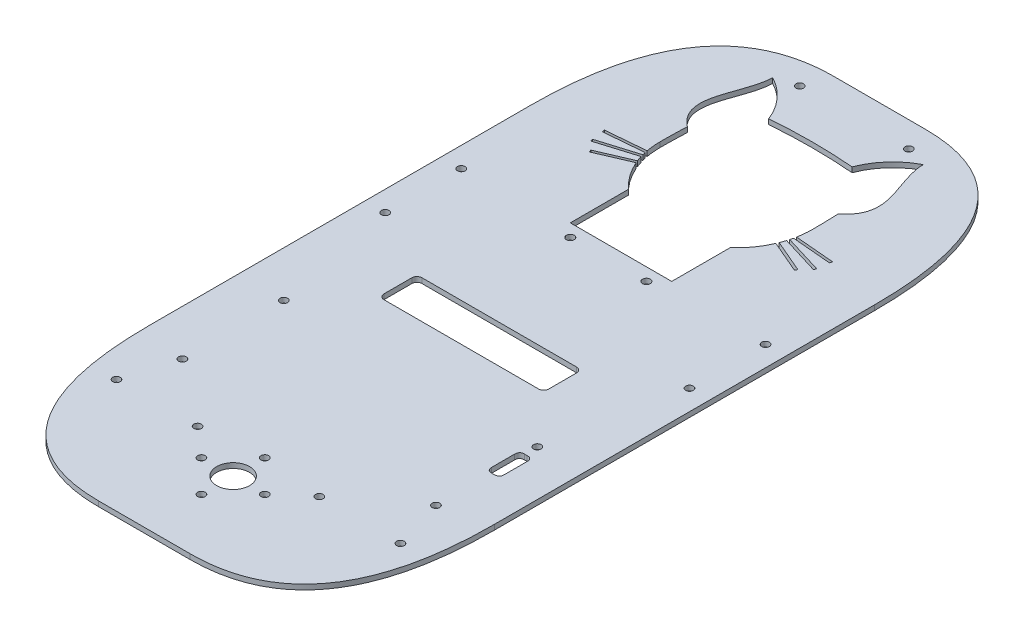
from build123d import *

# Parameters (mm, degrees)
SKETCH_1_W             = 136
SKETCH_1_H             = 290
EXTRUDE_532_DEPTH      = 2
SKETCH_12_R            = 1.5
CUT_EXTRUDE_1027_DEPTH = 174.862014253
SKETCH_9_R             = 6.5
SKETCH_9_R_2           = 1.5
CUT_EXTRUDE_2849_DEPTH = 174.862014253
SKETCH_5_R             = 1.5
RASPBERRY_DEPTH        = 174.862014253
SKETCH_11_W            = 65
SKETCH_11_H            = 15
CUT_EXTRUDE_3946_DEPTH = 174.862014253
FILLET_3_R             = 2
CUT_EXTRUDE_5288_REACH = 175.862
SKETCH_15_R            = 1.5
CUT_EXTRUDE_5884_REACH = 175.862
SKETCH_16_R            = 1.5
CUT_EXTRUDE_6361_REACH = 175.862
SKETCH_17_W            = 5
SKETCH_17_H            = 13
FILLET_4_SIZE          = 70
FILLET_4_SIZE_2        = 50
FILLET_5_SIZE          = 50
FILLET_5_SIZE_2        = 70
FILLET_6_SIZE          = 2
CUT_EXTRUDE_4_REACH    = 175.862
SKETCH_18_R            = 1.55


with BuildPart() as part:
    # Эскиз1 → Extrude 532 (new body)
    with BuildSketch(Plane(origin=(0, 0, 0), x_dir=(1, 0, 0), z_dir=(0, 1, 0))):
        with Locations((0, 15)):
            Rectangle(SKETCH_1_W, SKETCH_1_H)
    extrude(amount=EXTRUDE_532_DEPTH)

    # Эскиз12 → Cut-Extrude 1027 (cut, through all)
    with BuildSketch(Plane(origin=(0, 2, 0), x_dir=(1, 0, 0), z_dir=(0, 1, 0))):
        with Locations(Location((60, 55, 0), (0, 0, 270))):
            Circle(SKETCH_12_R)
        with Locations(Location((-60, 55, 0), (0, 0, 270))):
            Circle(SKETCH_12_R)
        with Locations(Location((-60, 25, 0), (0, 0, 270))):
            Circle(SKETCH_12_R)
        with Locations(Location((60, 25, 0), (0, 0, 270))):
            Circle(SKETCH_12_R)
    extrude(amount=-CUT_EXTRUDE_1027_DEPTH, mode=Mode.SUBTRACT)

    # Эскиз9 → Cut-Extrude 2849 (cut, through all)
    with BuildSketch(Plane(origin=(0, 2, 0), x_dir=(1, 0, 0), z_dir=(0, 1, 0))):
        with Locations(Location((0, -95, 0), (0, 0, 270))):
            Circle(SKETCH_9_R)
        with Locations(Location((0, -82.5, 0), (0, 0, 270))):
            Circle(SKETCH_9_R_2)
        with Locations(Location((12.5, -95, 0), (0, 0, 270))):
            Circle(SKETCH_9_R_2)
        with Locations(Location((-12.5, -95, 0), (0, 0, 270))):
            Circle(SKETCH_9_R_2)
        with Locations(Location((0, -107.5, 0), (0, 0, 270))):
            Circle(SKETCH_9_R_2)
    extrude(amount=-CUT_EXTRUDE_2849_DEPTH, mode=Mode.SUBTRACT)

    # Эскиз5 → raspberry (cut, through all)
    with BuildSketch(Plane(origin=(0, 2, 0), x_dir=(1, 0, 0), z_dir=(0, 1, 0))):
        with Locations(Location((-50, -25, 0), (0, 0, 270))):
            Circle(SKETCH_5_R)
        with Locations(Location((50, -25, 0), (0, 0, 270))):
            Circle(SKETCH_5_R)
        with Locations(Location((50, -65, 0), (0, 0, 270))):
            Circle(SKETCH_5_R)
        with Locations(Location((-50, -65, 0), (0, 0, 270))):
            Circle(SKETCH_5_R)
    extrude(amount=-RASPBERRY_DEPTH, mode=Mode.SUBTRACT)

    # Эскиз11 → Cut-Extrude 3946 (cut, through all)
    with BuildSketch(Plane(origin=(0, 2, 0), x_dir=(1, 0, 0), z_dir=(0, 1, 0))):
        with Locations((0, 2.5)):
            Rectangle(SKETCH_11_W, SKETCH_11_H)
    extrude(amount=-CUT_EXTRUDE_3946_DEPTH, mode=Mode.SUBTRACT)

    # Скругление3
    fillet_3_edges = [part.edges().sort_by_distance(p)[0] for p in [
        (-32.5, 1, 5),
        (-32.5, 1, -10),
        (32.5, 1, -10),
        (32.5, 1, 5),
    ]]
    fillet(fillet_3_edges, radius=FILLET_3_R)

    # Эскиз15 → Cut-Extrude 5288 (cut, up to next)
    with BuildSketch(Plane(origin=(0, 2, 0), x_dir=(1, 0, 0), z_dir=(0, 1, 0)), mode=Mode.PRIVATE) as cut_extrude_5288_sk1:
        with Locations(Location((21.5, 150, 0), (0, 0, 270))):
            Circle(SKETCH_15_R)
    cut_extrude_5288_tool1 = extrude(cut_extrude_5288_sk1.sketch, amount=-CUT_EXTRUDE_5288_REACH, mode=Mode.PRIVATE) & part.part
    # Эскиз15 → Cut-Extrude 5288 (cut, up to next)
    with BuildSketch(Plane(origin=(0, 2, 0), x_dir=(1, 0, 0), z_dir=(0, 1, 0)), mode=Mode.PRIVATE) as cut_extrude_5288_sk2:
        with Locations(Location((-21.5, 150, 0), (0, 0, 270))):
            Circle(SKETCH_15_R)
    cut_extrude_5288_tool2 = extrude(cut_extrude_5288_sk2.sketch, amount=-CUT_EXTRUDE_5288_REACH, mode=Mode.PRIVATE) & part.part
    add(cut_extrude_5288_tool1.solids().sort_by_distance((21.5, 2, -150))[0], mode=Mode.SUBTRACT)
    add(cut_extrude_5288_tool2.solids().sort_by_distance((-21.5, 2, -150))[0], mode=Mode.SUBTRACT)

    # Эскиз16 → Cut-Extrude 5884 (cut, up to next)
    with BuildSketch(Plane(origin=(0, 2, 0), x_dir=(1, 0, 0), z_dir=(0, 1, 0)), mode=Mode.PRIVATE) as cut_extrude_5884_sk1:
        with Locations(Location((-56, -85, 0), (0, 0, 270))):
            Circle(SKETCH_16_R)
    cut_extrude_5884_tool1 = extrude(cut_extrude_5884_sk1.sketch, amount=-CUT_EXTRUDE_5884_REACH, mode=Mode.PRIVATE) & part.part
    # Эскиз16 → Cut-Extrude 5884 (cut, up to next)
    with BuildSketch(Plane(origin=(0, 2, 0), x_dir=(1, 0, 0), z_dir=(0, 1, 0)), mode=Mode.PRIVATE) as cut_extrude_5884_sk2:
        with Locations(Location((-24, -85, 0), (0, 0, 270))):
            Circle(SKETCH_16_R)
    cut_extrude_5884_tool2 = extrude(cut_extrude_5884_sk2.sketch, amount=-CUT_EXTRUDE_5884_REACH, mode=Mode.PRIVATE) & part.part
    # Эскиз16 → Cut-Extrude 5884 (cut, up to next)
    with BuildSketch(Plane(origin=(0, 2, 0), x_dir=(1, 0, 0), z_dir=(0, 1, 0)), mode=Mode.PRIVATE) as cut_extrude_5884_sk3:
        with Locations(Location((24, -85, 0), (0, 0, 270))):
            Circle(SKETCH_16_R)
    cut_extrude_5884_tool3 = extrude(cut_extrude_5884_sk3.sketch, amount=-CUT_EXTRUDE_5884_REACH, mode=Mode.PRIVATE) & part.part
    # Эскиз16 → Cut-Extrude 5884 (cut, up to next)
    with BuildSketch(Plane(origin=(0, 2, 0), x_dir=(1, 0, 0), z_dir=(0, 1, 0)), mode=Mode.PRIVATE) as cut_extrude_5884_sk4:
        with Locations(Location((56, -85, 0), (0, 0, 270))):
            Circle(SKETCH_16_R)
    cut_extrude_5884_tool4 = extrude(cut_extrude_5884_sk4.sketch, amount=-CUT_EXTRUDE_5884_REACH, mode=Mode.PRIVATE) & part.part
    add(cut_extrude_5884_tool1.solids().sort_by_distance((-56, 2, 85))[0], mode=Mode.SUBTRACT)
    add(cut_extrude_5884_tool2.solids().sort_by_distance((-24, 2, 85))[0], mode=Mode.SUBTRACT)
    add(cut_extrude_5884_tool3.solids().sort_by_distance((24, 2, 85))[0], mode=Mode.SUBTRACT)
    add(cut_extrude_5884_tool4.solids().sort_by_distance((56, 2, 85))[0], mode=Mode.SUBTRACT)

    # Эскиз17 → Cut-Extrude 6361 (cut, up to next)
    with BuildSketch(Plane(origin=(0, 2, 0), x_dir=(1, 0, 0), z_dir=(0, 1, 0)), mode=Mode.PRIVATE) as cut_extrude_6361_sk1:
        with Locations((50.5, -36.5)):
            Rectangle(SKETCH_17_W, SKETCH_17_H)
    cut_extrude_6361_tool1 = extrude(cut_extrude_6361_sk1.sketch, amount=-CUT_EXTRUDE_6361_REACH, mode=Mode.PRIVATE) & part.part
    add(cut_extrude_6361_tool1.solids().sort_by_distance((50.5, 2, 36.5))[0], mode=Mode.SUBTRACT)

    # Скругление4
    # a fillet whose section is not a circle: 70, 50 mm, written as the material it takes off along each edge
    with BuildSketch(Plane(origin=(68, -175, 130), x_dir=(0, 0, -1), z_dir=(0, 1, 0))) as fillet_4_piece_1:
        with BuildLine():
            Bezier((FILLET_4_SIZE, 0), (0, 0), (0, FILLET_4_SIZE_2), weights=[1, 1, 1])
            Line((0, FILLET_4_SIZE_2), (0, 0))
            Line((0, 0), (FILLET_4_SIZE, 0))
        make_face()
    extrude(amount=352, mode=Mode.SUBTRACT)
    with BuildSketch(Plane(origin=(-68, -175, -160), x_dir=(1, 0, 0), z_dir=(0, 1, 0))) as fillet_4_piece_2:
        with BuildLine():
            Bezier((FILLET_4_SIZE_2, 0), (0, 0), (0, -FILLET_4_SIZE), weights=[1, 1, 1])
            Line((0, -FILLET_4_SIZE), (0, 0))
            Line((0, 0), (FILLET_4_SIZE_2, 0))
        make_face()
    extrude(amount=352, mode=Mode.SUBTRACT)

    # Скругление5
    # a fillet whose section is not a circle: 70, 50 mm, written as the material it takes off along each edge
    with BuildSketch(Plane(origin=(-68, -175, 130), x_dir=(1, 0, 0), z_dir=(0, 1, 0))) as fillet_5_piece_1:
        with BuildLine():
            Bezier((FILLET_5_SIZE, 0), (0, 0), (0, FILLET_5_SIZE_2), weights=[1, 1, 1])
            Line((0, FILLET_5_SIZE_2), (0, 0))
            Line((0, 0), (FILLET_5_SIZE, 0))
        make_face()
    extrude(amount=352, mode=Mode.SUBTRACT)
    with BuildSketch(Plane(origin=(68, -175, -160), x_dir=(0, 0, 1), z_dir=(0, 1, 0))) as fillet_5_piece_2:
        with BuildLine():
            Bezier((FILLET_5_SIZE_2, 0), (0, 0), (0, -FILLET_5_SIZE), weights=[1, 1, 1])
            Line((0, -FILLET_5_SIZE), (0, 0))
            Line((0, 0), (FILLET_5_SIZE_2, 0))
        make_face()
    extrude(amount=352, mode=Mode.SUBTRACT)

    # Скругление6
    # a fillet whose section is not a circle: 2 mm, written as the material it adds along each edge
    with BuildSketch(Plane(origin=(48, 2, 43), x_dir=(0, 0, -1), z_dir=(0, -1, 0)), Plane(origin=(48, 2, 30), x_dir=(1, 0, 0), z_dir=(0, -1, 0))) as fillet_6_piece_1:
        with BuildLine():
            Bezier((FILLET_6_SIZE, 0), (0, 0), (0, FILLET_6_SIZE), weights=[1, 1, 1])
            Line((0, FILLET_6_SIZE), (0, 0))
            Line((0, 0), (FILLET_6_SIZE, 0))
        make_face()
    extrude(amount=2)
    with BuildSketch(Plane(origin=(53, 2, 43), x_dir=(0, 0, -1), z_dir=(0, -1, 0)), Plane(origin=(53, 2, 30), x_dir=(-1, 0, 0), z_dir=(0, -1, 0))) as fillet_6_piece_2:
        with BuildLine():
            Bezier((FILLET_6_SIZE, 0), (0, 0), (0, -FILLET_6_SIZE), weights=[1, 1, 1])
            Line((0, -FILLET_6_SIZE), (0, 0))
            Line((0, 0), (FILLET_6_SIZE, 0))
        make_face()
    extrude(amount=2)

    # Эскиз18 → Вырез-Вытянуть4 (cut, up to next)
    with BuildSketch(Plane(origin=(0, 2, 0), x_dir=(1, 0, 0), z_dir=(0, 1, 0)), mode=Mode.PRIVATE) as cut_extrude_4_sk1:
        with BuildLine():
            add(Edge.make_bspline(
                [(-29.757129837, 113.912310706), (-42.101818094, 123.501439862), (-29.756218039, 136.26498896), (-29.713493464, 147.52085668)],
                knots=[0, 0, 0, 0, 1, 1, 1, 1], degree=3))
            ThreePointArc((-29.757129837, 113.912310706), (-29.187292778, 122.65055769), (-28.284271247, 131.360679775))
            ThreePointArc((-28.284271247, 131.360679775), (-22.373119008, 132.11163358), (-16.442304578, 132.687040048))
            ThreePointArc((-16.442304578, 132.687040048), (-21.714421333, 141.323794232), (-29.713493464, 147.52085668))
        make_face()
    cut_extrude_4_tool1 = extrude(cut_extrude_4_sk1.sketch, amount=-CUT_EXTRUDE_4_REACH, mode=Mode.PRIVATE) & part.part
    # Эскиз18 → Вырез-Вытянуть4 (cut, up to next)
    with BuildSketch(Plane(origin=(0, 2, 0), x_dir=(1, 0, 0), z_dir=(0, 1, 0)), mode=Mode.PRIVATE) as cut_extrude_4_sk2:
        with BuildLine():
            ThreePointArc((28.284271247, 131.360679775), (29.187292778, 122.65055769), (29.757129837, 113.912310706))
            add(Edge.make_bspline(
                [(29.757129837, 113.912310706), (42.101818094, 123.501439862), (29.756218039, 136.26498896), (29.713493464, 147.52085668)],
                knots=[0, 0, 0, 0, 1, 1, 1, 1], degree=3))
            ThreePointArc((29.713493464, 147.52085668), (21.714421333, 141.323794232), (16.442304578, 132.687040048))
            ThreePointArc((16.442304578, 132.687040048), (22.373119008, 132.11163358), (28.284271247, 131.360679775))
        make_face()
    cut_extrude_4_tool2 = extrude(cut_extrude_4_sk2.sketch, amount=-CUT_EXTRUDE_4_REACH, mode=Mode.PRIVATE) & part.part
    # Эскиз18 → Вырез-Вытянуть4 (cut, up to next)
    with BuildSketch(Plane(origin=(0, 2, 0), x_dir=(1, 0, 0), z_dir=(0, 1, 0)), mode=Mode.PRIVATE) as cut_extrude_4_sk3:
        with BuildLine():
            ThreePointArc((-28.696314755, 94.613021832), (-28.497173289, 93.984587063), (-28.284271247, 93.360679775))
            Line((-28.284271247, 93.360679775), (28.284271247, 93.360679775))
            ThreePointArc((28.284271247, 93.360679775), (28.497173289, 93.984587063), (28.696314755, 94.613021832))
            Line((28.696314755, 94.613021832), (43.93528044, 89.967642788))
            Line((43.93528044, 89.967642788), (44.226869038, 90.924186613))
            Line((44.226869038, 90.924186613), (28.971956525, 95.574426818))
            ThreePointArc((28.971956525, 95.574426818), (29.127049395, 96.176322214), (29.269639256, 96.781301549))
            Line((29.269639256, 96.781301549), (44.869506647, 95.428597547))
            Line((44.869506647, 95.428597547), (44.955895008, 96.424859085))
            Line((44.955895008, 96.424859085), (29.473963289, 97.767336586))
            ThreePointArc((29.473963289, 97.767336586), (29.868201307, 100.551667375), (30, 103.360679775))
            ThreePointArc((30, 103.360679775), (29.939274419, 108.63789261), (29.757129837, 113.912310706))
            ThreePointArc((29.757129837, 113.912310706), (29.187292778, 122.65055769), (28.284271247, 131.360679775))
            ThreePointArc((28.284271247, 131.360679775), (22.373119008, 132.11163358), (16.442304578, 132.687040048))
            ThreePointArc((16.442304578, 132.687040048), (0, 133.360679775), (-16.442304578, 132.687040048))
            ThreePointArc((-16.442304578, 132.687040048), (-22.373119008, 132.11163358), (-28.284271247, 131.360679775))
            ThreePointArc((-28.284271247, 131.360679775), (-29.187292778, 122.65055769), (-29.757129837, 113.912310706))
            ThreePointArc((-29.757129837, 113.912310706), (-29.939274419, 108.63789261), (-30, 103.360679775))
            ThreePointArc((-30, 103.360679775), (-29.868201307, 100.551667375), (-29.473963289, 97.767336586))
            Line((-29.473963289, 97.767336586), (-44.955895008, 96.424859085))
            Line((-44.955895008, 96.424859085), (-44.869506647, 95.428597547))
            Line((-44.869506647, 95.428597547), (-29.269639256, 96.781301549))
            ThreePointArc((-29.269639256, 96.781301549), (-29.127049395, 96.176322214), (-28.971956525, 95.574426818))
            Line((-28.971956525, 95.574426818), (-44.226869038, 90.924186613))
            Line((-44.226869038, 90.924186613), (-43.93528044, 89.967642788))
            Line((-43.93528044, 89.967642788), (-28.696314755, 94.613021832))
        make_face()
    cut_extrude_4_tool3 = extrude(cut_extrude_4_sk3.sketch, amount=-CUT_EXTRUDE_4_REACH, mode=Mode.PRIVATE) & part.part
    # Эскиз18 → Вырез-Вытянуть4 (cut, up to next)
    with BuildSketch(Plane(origin=(0, 2, 0), x_dir=(1, 0, 0), z_dir=(0, 1, 0)), mode=Mode.PRIVATE) as cut_extrude_4_sk4:
        with BuildLine():
            Line((-20, 81), (-20, 58))
            Line((-20, 58), (-10, 58))
            Line((-10, 58), (10, 58))
            Line((10, 58), (20, 58))
            Line((20, 58), (20, 81))
            ThreePointArc((20, 81), (24.357687682, 85.84774025), (27.565421121, 91.522286369))
            Line((27.565421121, 91.522286369), (40.420260253, 86.001578299))
            Line((40.420260253, 86.001578299), (40.814873367, 86.92042567))
            Line((40.814873367, 86.92042567), (27.944715855, 92.447712453))
            ThreePointArc((27.944715855, 92.447712453), (28.118199177, 92.902817899), (28.284271247, 93.360679775))
            Line((28.284271247, 93.360679775), (-28.284271247, 93.360679775))
            ThreePointArc((-28.284271247, 93.360679775), (-28.118199177, 92.902817899), (-27.944715855, 92.447712453))
            Line((-27.944715855, 92.447712453), (-40.814873367, 86.92042567))
            Line((-40.814873367, 86.92042567), (-40.420260253, 86.001578299))
            Line((-40.420260253, 86.001578299), (-27.565421121, 91.522286369))
            ThreePointArc((-27.565421121, 91.522286369), (-24.357687682, 85.84774025), (-20, 81))
        make_face()
    cut_extrude_4_tool4 = extrude(cut_extrude_4_sk4.sketch, amount=-CUT_EXTRUDE_4_REACH, mode=Mode.PRIVATE) & part.part
    # Эскиз18 → Вырез-Вытянуть4 (cut, up to next)
    with BuildSketch(Plane(origin=(0, 2, 0), x_dir=(1, 0, 0), z_dir=(0, 1, 0)), mode=Mode.PRIVATE) as cut_extrude_4_sk5:
        with Locations(Location((15, 53, 0), (0, 0, 270))):
            Circle(SKETCH_18_R)
    cut_extrude_4_tool5 = extrude(cut_extrude_4_sk5.sketch, amount=-CUT_EXTRUDE_4_REACH, mode=Mode.PRIVATE) & part.part
    # Эскиз18 → Вырез-Вытянуть4 (cut, up to next)
    with BuildSketch(Plane(origin=(0, 2, 0), x_dir=(1, 0, 0), z_dir=(0, 1, 0)), mode=Mode.PRIVATE) as cut_extrude_4_sk6:
        with Locations(Location((-15, 53, 0), (0, 0, 270))):
            Circle(SKETCH_18_R)
    cut_extrude_4_tool6 = extrude(cut_extrude_4_sk6.sketch, amount=-CUT_EXTRUDE_4_REACH, mode=Mode.PRIVATE) & part.part
    add(cut_extrude_4_tool1.solids().sort_by_distance((-27.967996, 2, -132.780644))[0], mode=Mode.SUBTRACT)
    add(cut_extrude_4_tool2.solids().sort_by_distance((27.967996, 2, -132.780644))[0], mode=Mode.SUBTRACT)
    add(cut_extrude_4_tool3.solids().sort_by_distance((0, 2, -112.437145))[0], mode=Mode.SUBTRACT)
    add(cut_extrude_4_tool4.solids().sort_by_distance((0, 2, -76.945616))[0], mode=Mode.SUBTRACT)
    add(cut_extrude_4_tool5.solids().sort_by_distance((15, 2, -53))[0], mode=Mode.SUBTRACT)
    add(cut_extrude_4_tool6.solids().sort_by_distance((-15, 2, -53))[0], mode=Mode.SUBTRACT)


solid = part.part
